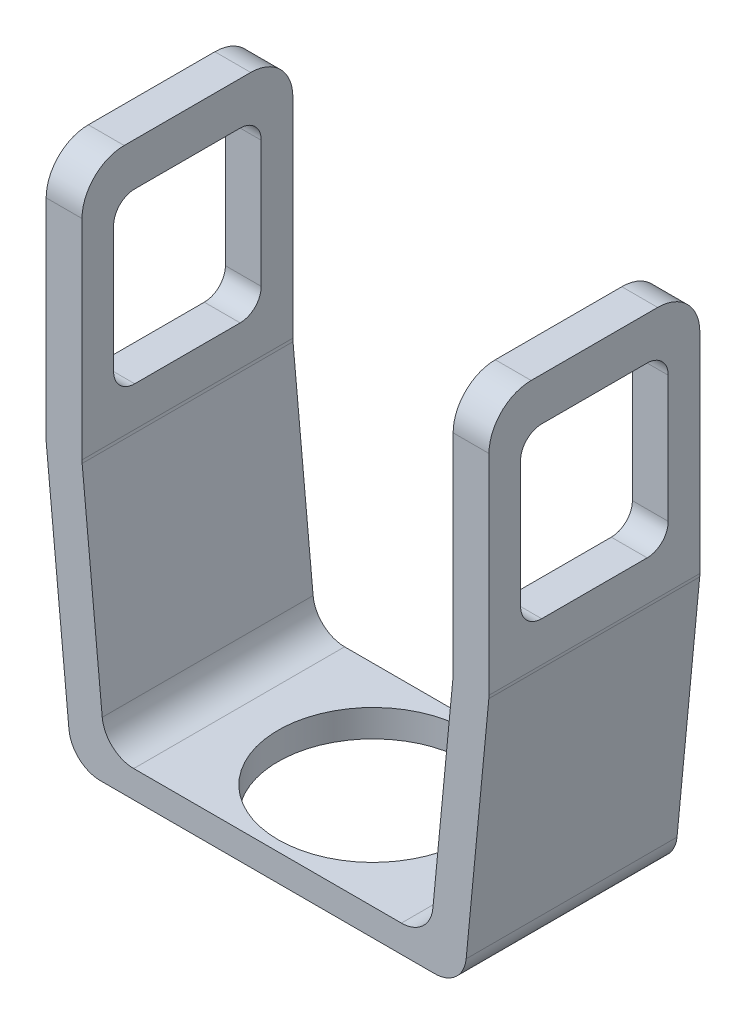
from build123d import *

# Parameters (mm, degrees)
SALIENTE_EXTRUIR1_DEPTH = 5
CROQUIS2_R              = 4.5
CORTAR_EXTRUIR1_DEPTH   = 28.257564023
CROQUIS3_W              = 7
CROQUIS3_H              = 8
CORTAR_EXTRUIR2_DEPTH   = 33.767740179
REDONDEO1_R             = 2
REDONDEO2_R             = 1


with BuildPart() as part:
    # Croquis1 → Saliente-Extruir1 (new, symmetric)
    with BuildSketch(Plane.XY):
        with BuildLine():
            Line((-8.8, 24.652074892), (-10.5, 24.652074892))
            Line((-10.5, 24.652074892), (-10.5, 12.723760553))
            ThreePointArc((-10.5, 12.723760553), (-10.498289984, 12.652156614), (-10.493163835, 12.580715934))
            Line((-10.493163835, 12.580715934), (-9.417931151, 1.356955381))
            ThreePointArc((-9.417931151, 1.356955381), (-8.933586693, 0.389917361), (-7.924767316, 0))
            Line((-7.924767316, 0), (7.924767316, 0))
            ThreePointArc((7.924767316, 0), (8.933586693, 0.389917361), (9.417931151, 1.356955381))
            Line((9.417931151, 1.356955381), (10.493163835, 12.580715934))
            ThreePointArc((10.493163835, 12.580715934), (10.498289984, 12.652156614), (10.5, 12.723760553))
            Line((10.5, 12.723760553), (10.5, 24.652074892))
            Line((10.5, 24.652074892), (8.8, 24.652074892))
            Line((8.8, 24.652074892), (8.8, 12.739594081))
            ThreePointArc((8.8, 12.739594081), (8.798289984, 12.667990142), (8.793163835, 12.596549461))
            Line((8.793163835, 12.596549461), (7.839995893, 2.646955381))
            ThreePointArc((7.839995893, 2.646955381), (7.355651435, 1.679917361), (6.346832058, 1.29))
            Line((6.346832058, 1.29), (-6.346832058, 1.29))
            ThreePointArc((-6.346832058, 1.29), (-7.355651435, 1.679917361), (-7.839995893, 2.646955381))
            Line((-7.839995893, 2.646955381), (-8.793163835, 12.596549461))
            ThreePointArc((-8.793163835, 12.596549461), (-8.798289984, 12.667990142), (-8.8, 12.739594081))
            Line((-8.8, 12.739594081), (-8.8, 24.652074892))
        make_face()
    extrude(amount=SALIENTE_EXTRUIR1_DEPTH, both=True)

    # Croquis2 → Cortar-Extruir1 (cut, through all)
    with BuildSketch(Plane.XZ):
        Circle(CROQUIS2_R)
    extrude(amount=-CORTAR_EXTRUIR1_DEPTH, mode=Mode.SUBTRACT)

    # Croquis3 → Cortar-Extruir2 (cut, through all)
    with BuildSketch(Plane(origin=(10.5, 0, 0), x_dir=(0, 0, -1), z_dir=(1, 0, 0))):
        with Locations((0, 18.616395413)):
            Rectangle(CROQUIS3_W, CROQUIS3_H)
    extrude(amount=-CORTAR_EXTRUIR2_DEPTH, mode=Mode.SUBTRACT)

    # Redondeo1
    redondeo1_edges = [part.edges().sort_by_distance(p)[0] for p in [
        (9.65, 24.652074892, -5),
        (9.65, 24.652074892, 5),
        (-9.65, 24.652074892, 5),
        (-9.65, 24.652074892, -5),
    ]]
    fillet(redondeo1_edges, radius=REDONDEO1_R)

    # Redondeo2
    redondeo2_edges = [part.edges().sort_by_distance(p)[0] for p in [
        (9.65, 22.616395413, -3.5),
        (9.65, 22.616395413, 3.5),
        (9.65, 14.616395413, 3.5),
        (9.65, 14.616395413, -3.5),
        (-9.65, 14.616395413, -3.5),
        (-9.65, 22.616395413, 3.5),
        (-9.65, 22.616395413, -3.5),
        (-9.65, 14.616395413, 3.5),
    ]]
    fillet(redondeo2_edges, radius=REDONDEO2_R)


solid = part.part
